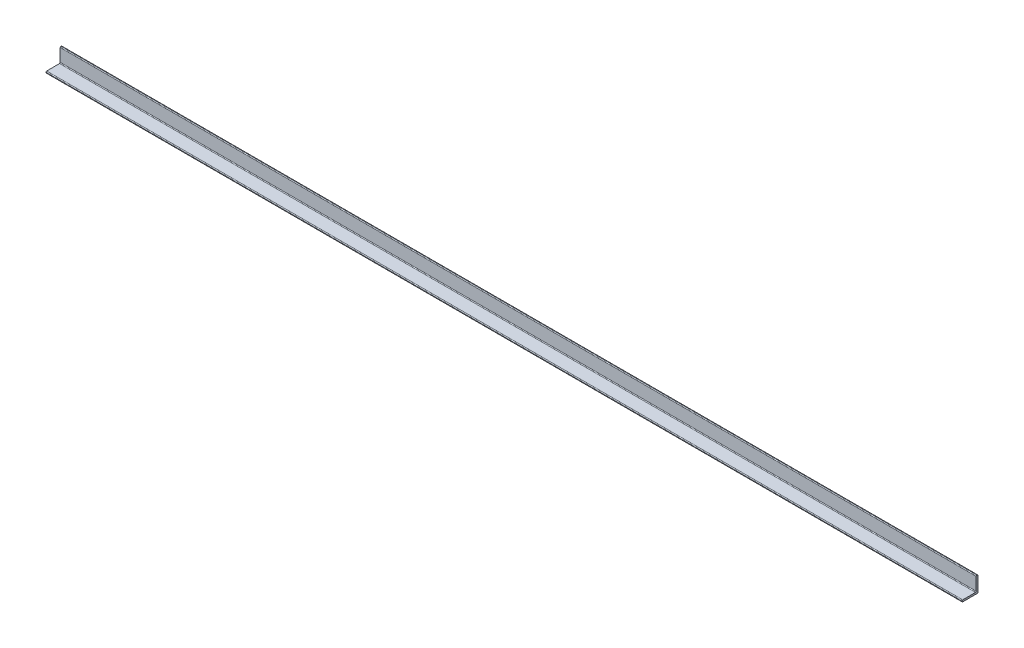
from build123d import *

# Parameters (mm, degrees)
SKETCH1_W           = 1288
SKETCH1_H           = 22.5
BOSS_EXTRUDE1_DEPTH = 2.5
SKETCH2_W           = 1288
SKETCH2_H           = 2.5
BOSS_EXTRUDE2_DEPTH = 20
FILLET1_R           = 1


with BuildPart() as part:
    # Sketch1 → Boss-Extrude1 (new body)
    with BuildSketch(Plane(origin=(0, 0, 0), x_dir=(1, 0, 0), z_dir=(0, 1, 0))):
        Rectangle(SKETCH1_W, SKETCH1_H)
    extrude(amount=BOSS_EXTRUDE1_DEPTH)

    # Sketch2 → Boss-Extrude2 (add)
    with BuildSketch(Plane(origin=(0, 2.5, 0), x_dir=(1, 0, 0), z_dir=(0, 1, 0))):
        with Locations((0, 10)):
            Rectangle(SKETCH2_W, SKETCH2_H)
    extrude(amount=BOSS_EXTRUDE2_DEPTH)

    # Fillet1
    fillet1_edges = [part.edges().sort_by_distance(p)[0] for p in [
        (0, 0, -11.25),
        (0, 0, 11.25),
        (0, 2.5, 11.25),
        (0, 2.5, -8.75),
        (0, 22.5, -8.75),
        (0, 22.5, -11.25),
    ]]
    fillet(fillet1_edges, radius=FILLET1_R)


solid = part.part
